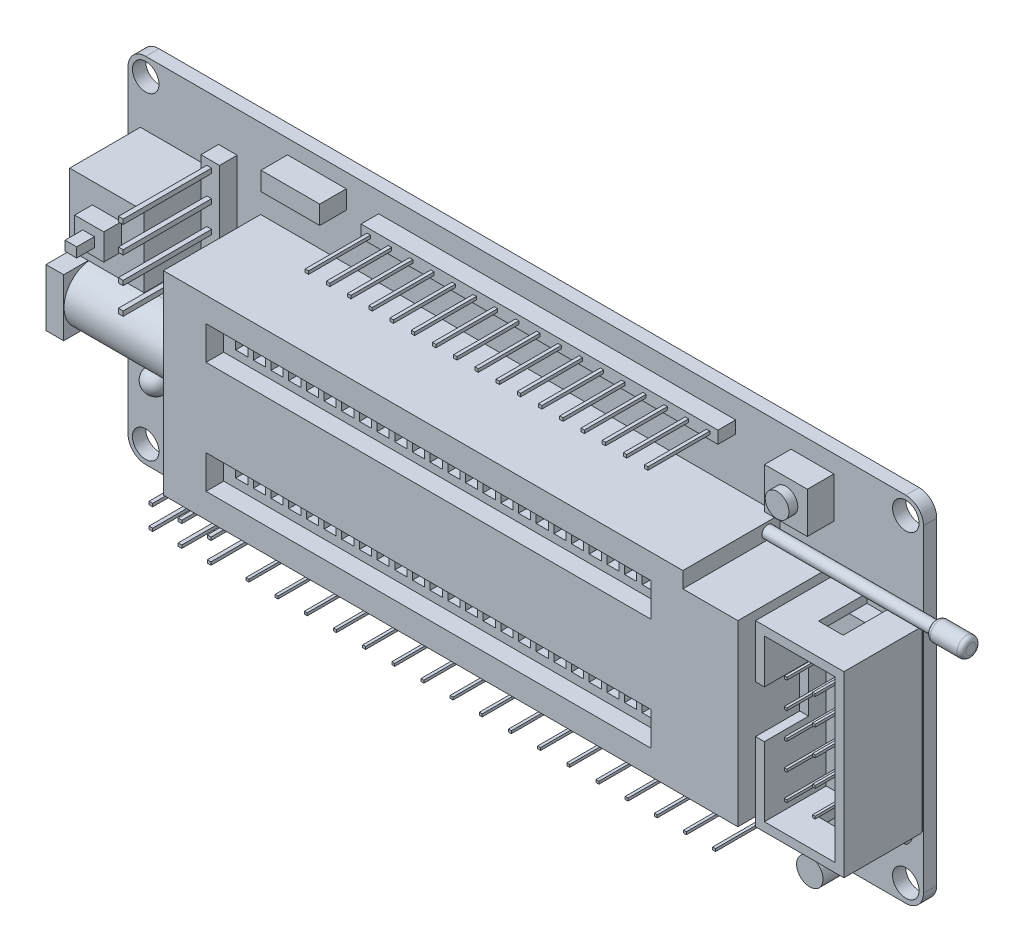
from build123d import *

# Parameters (mm, degrees)
SKETCH_1_W                = 90
SKETCH_1_H                = 40
EXTRUDE_1_DEPTH           = 1.5
SKETCH_2_W                = 65
SKETCH_2_H                = 22
EXTRUDE_2_DEPTH           = 11
SKETCH_3_W                = 6.225087501
SKETCH_3_H                = 1.796883592
CUT_EXTRUDE_1_DEPTH       = 69
SKETCH_4_W                = 10
SKETCH_4_H                = 20.203116408
EXTRUDE_3_DEPTH           = 9
SKETCH_5_W                = 8
SKETCH_5_H                = 18.203116408
CUT_EXTRUDE_3_DEPTH       = 9
SKETCH_6_W                = 2.774855054
SKETCH_6_H                = 5.475338092
CUT_EXTRUDE_4_DEPTH       = 1
SKETCH_7_W                = 2.774855054
SKETCH_7_H                = 5.475338092
CUT_EXTRUDE_5_DEPTH       = 1
SKETCH_8_W                = 8
SKETCH_8_H                = 18.203116408
EXTRUDE_4_DEPTH           = 2
SKETCH_9_W                = 0.285419249
SKETCH_9_H                = 0.292362524
EXTRUDE_5_DEPTH           = 7
PATTERN_LINEAR_1_COUNT    = 5
PATTERN_LINEAR_1_PITCH    = 3
SKETCH_10_W               = 50.34394713
SKETCH_10_H               = 3.791594345
CUT_EXTRUDE_6_DEPTH       = 2
SKETCH_11_W               = 9.860673025
SKETCH_11_H               = 5.03523729
SKETCH_11_W_2             = 56.436617954
SKETCH_11_H_2             = 1.888213984
EXTRUDE_6_DEPTH           = 2
SKETCH_12_W               = 13.626100034
SKETCH_12_H               = 6.476245966
EXTRUDE_7_DEPTH           = 6
SKETCH_13_R               = 3.238122983
EXTRUDE_8_DEPTH           = 13.5
SKETCH_14_W               = 6.561891238
SKETCH_14_H               = 6.476245966
EXTRUDE_9_DEPTH           = 2
SKETCH_15_R               = 2.43291979
CUT_EXTRUDE_7_DEPTH       = 12
SKETCH_16_R               = 0.262129878
EXTRUDE_10_DEPTH          = 10
SKETCH_17_W               = 8.42576521
SKETCH_17_H               = 8.004476949
EXTRUDE_11_DEPTH          = 8
SKETCH_18_W               = 3.290690735
SKETCH_18_H               = 2.961327036
EXTRUDE_12_DEPTH          = 2
SKETCH_19_W               = 1.308493341
SKETCH_19_H               = 1.101889129
EXTRUDE_13_DEPTH          = 2
SKETCH_20_W               = 2.106441302
SKETCH_20_H               = 11.164138903
EXTRUDE_14_DEPTH          = 2
SKETCH_21_W               = 4.844814995
SKETCH_21_H               = 4.634170865
EXTRUDE_15_DEPTH          = 3
SKETCH_22_R               = 1.343961461
EXTRUDE_16_DEPTH          = 1
FILLET_2_R                = 2
SKETCH_24_R               = 1.5
CUT_EXTRUDE_8_DEPTH       = 4
SKETCH_25_W               = 6.643715868
SKETCH_25_H               = 2.098015537
EXTRUDE_18_DEPTH          = 3
SKETCH_26_W               = 40.386799093
SKETCH_26_H               = 1.398677025
EXTRUDE_19_DEPTH          = 2
SKETCH_27_W               = 0.37978378
SKETCH_27_H               = 0.352656368
EXTRUDE_20_DEPTH          = 7
PATTERN_LINEAR_2_COUNT    = 17
PATTERN_LINEAR_2_PITCH    = 2.4
SKETCH_28_W               = 0.413208423
SKETCH_28_H               = 0.344340353
EXTRUDE_21_DEPTH          = 7
PATTERN_LINEAR_3_COUNT    = 3
PATTERN_LINEAR_3_PITCH    = 3.3
SKETCH_29_W               = 0.325528955
SKETCH_29_H               = 0.298401542
EXTRUDE_22_DEPTH          = 7
PATTERN_LINEAR_4_COUNT    = 17
PATTERN_LINEAR_4_PITCH    = 3.3
SKETCH_30_R               = 0.665362113
EXTRUDE_23_DEPTH          = 23
SKETCH_31_W               = 0.534821992
SKETCH_31_H               = 0.534821993
EXTRUDE_24_DEPTH          = 10
SKETCH_32_W               = 0.556921536
SKETCH_32_H               = 1.218265859
EXTRUDE_25_DEPTH          = 1
SKETCH_33_R               = 0.577662236
EXTRUDE_26_DEPTH          = 5
SKETCH_34_W               = 0.459120478
SKETCH_34_H               = 1.170459117
EXTRUDE_27_DEPTH          = 1
SKETCH_35_R               = 1.338295075
EXTRUDE_28_DEPTH          = 3
SKETCH_37_W               = 1.37126869
SKETCH_37_H               = 1.919776166
CUT_EXTRUDE_9_DEPTH       = 1
PATTERN_LINEAR_5_COUNT    = 24
PATTERN_LINEAR_5_PITCH    = 2
MIRROR_1_COPY_1_SKETCH_W  = 1.37126869
MIRROR_1_COPY_1_SKETCH_H  = 1.919776166
MIRROR_1_COPY_1_DEPTH     = 1
MIRROR_1_COPY_2_SKETCH_W  = 1.37126869
MIRROR_1_COPY_2_SKETCH_H  = 1.919776166
MIRROR_1_COPY_2_DEPTH     = 1
MIRROR_1_COPY_3_SKETCH_W  = 1.37126869
MIRROR_1_COPY_3_SKETCH_H  = 1.919776166
MIRROR_1_COPY_3_DEPTH     = 1
MIRROR_1_COPY_4_SKETCH_W  = 1.37126869
MIRROR_1_COPY_4_SKETCH_H  = 1.919776166
MIRROR_1_COPY_4_DEPTH     = 1
MIRROR_1_COPY_5_SKETCH_W  = 1.37126869
MIRROR_1_COPY_5_SKETCH_H  = 1.919776166
MIRROR_1_COPY_5_DEPTH     = 1
MIRROR_1_COPY_6_SKETCH_W  = 1.37126869
MIRROR_1_COPY_6_SKETCH_H  = 1.919776166
MIRROR_1_COPY_6_DEPTH     = 1
MIRROR_1_COPY_7_SKETCH_W  = 1.37126869
MIRROR_1_COPY_7_SKETCH_H  = 1.919776166
MIRROR_1_COPY_7_DEPTH     = 1
MIRROR_1_COPY_8_SKETCH_W  = 1.37126869
MIRROR_1_COPY_8_SKETCH_H  = 1.919776166
MIRROR_1_COPY_8_DEPTH     = 1
MIRROR_1_COPY_9_SKETCH_W  = 1.37126869
MIRROR_1_COPY_9_SKETCH_H  = 1.919776166
MIRROR_1_COPY_9_DEPTH     = 1
MIRROR_1_COPY_10_SKETCH_W = 1.37126869
MIRROR_1_COPY_10_SKETCH_H = 1.919776166
MIRROR_1_COPY_10_DEPTH    = 1
MIRROR_1_COPY_11_SKETCH_W = 1.37126869
MIRROR_1_COPY_11_SKETCH_H = 1.919776166
MIRROR_1_COPY_11_DEPTH    = 1
MIRROR_1_COPY_12_SKETCH_W = 1.37126869
MIRROR_1_COPY_12_SKETCH_H = 1.919776166
MIRROR_1_COPY_12_DEPTH    = 1
MIRROR_1_COPY_13_SKETCH_W = 1.37126869
MIRROR_1_COPY_13_SKETCH_H = 1.919776166
MIRROR_1_COPY_13_DEPTH    = 1
MIRROR_1_COPY_14_SKETCH_W = 1.37126869
MIRROR_1_COPY_14_SKETCH_H = 1.919776166
MIRROR_1_COPY_14_DEPTH    = 1
MIRROR_1_COPY_15_SKETCH_W = 1.37126869
MIRROR_1_COPY_15_SKETCH_H = 1.919776166
MIRROR_1_COPY_15_DEPTH    = 1
MIRROR_1_COPY_16_SKETCH_W = 1.37126869
MIRROR_1_COPY_16_SKETCH_H = 1.919776166
MIRROR_1_COPY_16_DEPTH    = 1
MIRROR_1_COPY_17_SKETCH_W = 1.37126869
MIRROR_1_COPY_17_SKETCH_H = 1.919776166
MIRROR_1_COPY_17_DEPTH    = 1
MIRROR_1_COPY_18_SKETCH_W = 1.37126869
MIRROR_1_COPY_18_SKETCH_H = 1.919776166
MIRROR_1_COPY_18_DEPTH    = 1
MIRROR_1_COPY_19_SKETCH_W = 1.37126869
MIRROR_1_COPY_19_SKETCH_H = 1.919776166
MIRROR_1_COPY_19_DEPTH    = 1
MIRROR_1_COPY_20_SKETCH_W = 1.37126869
MIRROR_1_COPY_20_SKETCH_H = 1.919776166
MIRROR_1_COPY_20_DEPTH    = 1
MIRROR_1_COPY_21_SKETCH_W = 1.37126869
MIRROR_1_COPY_21_SKETCH_H = 1.919776166
MIRROR_1_COPY_21_DEPTH    = 1
MIRROR_1_COPY_22_SKETCH_W = 1.37126869
MIRROR_1_COPY_22_SKETCH_H = 1.919776166
MIRROR_1_COPY_22_DEPTH    = 1
MIRROR_1_COPY_23_SKETCH_W = 1.37126869
MIRROR_1_COPY_23_SKETCH_H = 1.919776166
MIRROR_1_COPY_23_DEPTH    = 1
SKETCH_38_R               = 1.082743928
EXTRUDE_29_DEPTH          = 4
FILLET_3_R                = 0.5
SKETCH_39_R               = 1.5
EXTRUDE_30_DEPTH          = 7
SKETCH_41_W               = 0.342053881
SKETCH_41_H               = 0.863278842
EXTRUDE_31_DEPTH          = 1
SKETCH_42_R               = 0.5
EXTRUDE_32_DEPTH          = 5
SKETCH_43_W               = 2
SKETCH_43_H               = 5.366168078
CUT_EXTRUDE_10_DEPTH      = 5
SKETCH_44_W               = 0.619515708
SKETCH_44_H               = 6.476245966
CUT_EXTRUDE_11_DEPTH      = 0.1
SKETCH_46_W               = 0.219876874
SKETCH_46_H               = 20.203116408
CUT_EXTRUDE_12_DEPTH      = 0.1


with BuildPart() as part:
    # 草图1 → 凸台-拉伸1 (new body)
    with BuildSketch(Plane.XY):
        Rectangle(SKETCH_1_W, SKETCH_1_H)
    extrude(amount=EXTRUDE_1_DEPTH)

    # 草图2 → 凸台-拉伸2 (add)
    with BuildSketch(Plane.XY.offset(1.5)):
        with Locations((2.5, 0)):
            Rectangle(SKETCH_2_W, SKETCH_2_H)
    extrude(amount=EXTRUDE_2_DEPTH)

    # 草图3 → 切除-拉伸1 (cut)
    with BuildSketch(Plane.XY.offset(1.5)):
        with Locations((31.88745625, 10.101558204)):
            Rectangle(SKETCH_3_W, SKETCH_3_H)
    extrude(amount=CUT_EXTRUDE_1_DEPTH, mode=Mode.SUBTRACT)

    # 草图4 → 凸台-拉伸3 (add)
    with BuildSketch(Plane.XY.offset(1.5)):
        with Locations((40, -1.898441796)):
            Rectangle(SKETCH_4_W, SKETCH_4_H)
    extrude(amount=EXTRUDE_3_DEPTH)

    # 草图5 → 切除-拉伸3 (cut)
    with BuildSketch(Plane.XY.offset(10.5)):
        with Locations((40, -1.898441796)):
            Rectangle(SKETCH_5_W, SKETCH_5_H)
    extrude(amount=-CUT_EXTRUDE_3_DEPTH, mode=Mode.SUBTRACT)

    # 草图6 → 切除-拉伸4 (cut)
    with BuildSketch(Plane.XZ.offset(12)):
        with Locations((40, 4.237669046)):
            Rectangle(SKETCH_6_W, SKETCH_6_H)
    extrude(amount=-CUT_EXTRUDE_4_DEPTH, mode=Mode.SUBTRACT)

    # 草图7 → 切除-拉伸5 (cut)
    with BuildSketch(Plane.XZ.offset(-7.203116408)):
        with Locations((40, 4.237669046)):
            Rectangle(SKETCH_7_W, SKETCH_7_H)
    extrude(amount=-CUT_EXTRUDE_5_DEPTH, mode=Mode.SUBTRACT)

    # 草图8 → 凸台-拉伸4 (add)
    with BuildSketch(Plane.XY.offset(1.5)):
        with Locations((40, -1.898441796)):
            Rectangle(SKETCH_8_W, SKETCH_8_H)
    extrude(amount=EXTRUDE_4_DEPTH)

    # 草图9 → 凸台-拉伸5 (add)
    with BuildSketch(Plane.XY.offset(3.5)):
        with Locations((41.604609893, 4.276906518)):
            Rectangle(SKETCH_9_W, SKETCH_9_H)
        with Locations((38.395390107, 4.276906518)):
            Rectangle(SKETCH_9_W, SKETCH_9_H)
    extrude_5 = extrude(amount=EXTRUDE_5_DEPTH)

    # 阵列(线性)1: 凸台-拉伸5 ×5
    with Locations(*[(0, -i * PATTERN_LINEAR_1_PITCH, 0) for i in range(1, PATTERN_LINEAR_1_COUNT)]):
        add(extrude_5)

    # 草图10 → 切除-拉伸6 (cut)
    with BuildSketch(Plane.XY.offset(12.5)):
        with Locations((0, 6.319323908)):
            Rectangle(SKETCH_10_W, SKETCH_10_H)
        with Locations((0, -6.319323908)):
            Rectangle(SKETCH_10_W, SKETCH_10_H)
    extrude(amount=-CUT_EXTRUDE_6_DEPTH, mode=Mode.SUBTRACT)

    # 草图11 → 凸台-拉伸6 (add)
    with BuildSketch(Plane.XY.offset(1.5)):
        with Locations((-29.742403517, -15.797804223)):
            Rectangle(SKETCH_11_W, SKETCH_11_H)
        with Locations((4.665051295, -16.532109661)):
            Rectangle(SKETCH_11_W_2, SKETCH_11_H_2)
    extrude(amount=EXTRUDE_6_DEPTH)

    # 草图12 → 凸台-拉伸7 (add)
    with BuildSketch(Plane.XY.offset(1.5)):
        with Locations((-38.186949983, 0)):
            Rectangle(SKETCH_12_W, SKETCH_12_H)
    extrude(amount=EXTRUDE_7_DEPTH)

    # 草图13 → 凸台-拉伸8 (add)
    with BuildSketch(Plane.ZY.offset(45)):
        with Locations((7.5, 0)):
            Circle(SKETCH_13_R)
    extrude(amount=-EXTRUDE_8_DEPTH)

    # 草图14 → 凸台-拉伸9 (add)
    with BuildSketch(Plane.ZY.offset(45)):
        with Locations((7.5, 0)):
            Rectangle(SKETCH_14_W, SKETCH_14_H)
    extrude(amount=-EXTRUDE_9_DEPTH)

    # 草图15 → 切除-拉伸7 (cut)
    with BuildSketch(Plane.ZY.offset(45)):
        with Locations((7.340393145, 0)):
            Circle(SKETCH_15_R)
    extrude(amount=-CUT_EXTRUDE_7_DEPTH, mode=Mode.SUBTRACT)

    # 草图16 → 凸台-拉伸10 (add)
    with BuildSketch(Plane.ZY.offset(33)):
        with Locations((7.340393145, 0)):
            Circle(SKETCH_16_R)
    extrude(amount=EXTRUDE_10_DEPTH)

    # 草图17 → 凸台-拉伸11 (add)
    with BuildSketch(Plane.XY.offset(1.5)):
        with Locations((-39.390452357, 8.741731406)):
            Rectangle(SKETCH_17_W, SKETCH_17_H)
    extrude(amount=EXTRUDE_11_DEPTH)

    # 草图18 → 凸台-拉伸12 (add)
    with BuildSketch(Plane.XY.offset(9.5)):
        with Locations((-39.390452357, 8.942287584)):
            Rectangle(SKETCH_18_W, SKETCH_18_H)
    extrude(amount=EXTRUDE_12_DEPTH)

    # 草图19 → 凸台-拉伸13 (add)
    with BuildSketch(Plane.XY.offset(11.5)):
        with Locations((-39.466808754, 8.873419514)):
            Rectangle(SKETCH_19_W, SKETCH_19_H)
    extrude(amount=EXTRUDE_13_DEPTH)

    # 草图20 → 凸台-拉伸14 (add)
    with BuildSketch(Plane.XY.offset(1.5)):
        with Locations((-33.70306084, 9.900274122)):
            Rectangle(SKETCH_20_W, SKETCH_20_H)
    extrude(amount=EXTRUDE_14_DEPTH)

    # 草图21 → 凸台-拉伸15 (add)
    with BuildSketch(Plane.XY.offset(1.5)):
        with Locations((32.439196059, 15.692987704)):
            Rectangle(SKETCH_21_W, SKETCH_21_H)
    extrude(amount=EXTRUDE_15_DEPTH)

    # 草图22 → 凸台-拉伸16 (add)
    with BuildSketch(Plane.XY.offset(4.5)):
        with Locations((32.439196058, 15.742204428)):
            Circle(SKETCH_22_R)
    extrude(amount=EXTRUDE_16_DEPTH)

    # 圆角2
    fillet_2_edges = [part.edges().sort_by_distance(p)[0] for p in [
        (45, -20, 0.75),
        (-45, -20, 0.75),
        (-45, 20, 0.75),
        (45, 20, 0.75),
    ]]
    fillet(fillet_2_edges, radius=FILLET_2_R)

    # 草图24 → 切除-拉伸8 (cut)
    with BuildSketch(Plane.XY.offset(1.5)):
        with Locations((-43, -18)):
            Circle(SKETCH_24_R)
        with Locations((-43, 18)):
            Circle(SKETCH_24_R)
        with Locations((43, 18)):
            Circle(SKETCH_24_R)
        with Locations((43, -18)):
            Circle(SKETCH_24_R)
    extrude(amount=-CUT_EXTRUDE_8_DEPTH, mode=Mode.SUBTRACT)

    # 草图25 → 凸台-拉伸18 (add)
    with BuildSketch(Plane.XY.offset(1.5)):
        with Locations((-23.630953769, 17.312946387)):
            Rectangle(SKETCH_25_W, SKETCH_25_H)
    extrude(amount=EXTRUDE_18_DEPTH)

    # 草图26 → 凸台-拉伸19 (add)
    with BuildSketch(Plane.XY.offset(1.5)):
        with Locations((3.555830902, 17.050694445)):
            Rectangle(SKETCH_26_W, SKETCH_26_H)
    extrude(amount=EXTRUDE_19_DEPTH)

    # 草图27 → 凸台-拉伸20 (add)
    with BuildSketch(Plane.XY.offset(3.5)):
        with Locations((-15.764906068, 17.014648108)):
            Rectangle(SKETCH_27_W, SKETCH_27_H)
    extrude_20 = extrude(amount=EXTRUDE_20_DEPTH)

    # 阵列(线性)2: 凸台-拉伸20 ×17
    with Locations(*[(i * PATTERN_LINEAR_2_PITCH, 0, 0) for i in range(1, PATTERN_LINEAR_2_COUNT)]):
        add(extrude_20)

    # 草图28 → 凸台-拉伸21 (add)
    with BuildSketch(Plane.XY.offset(3.5)):
        with Locations((-33.418026477, -17.010820795)):
            Rectangle(SKETCH_28_W, SKETCH_28_H)
        with Locations((-33.418026477, -14.584787652)):
            Rectangle(SKETCH_28_W, SKETCH_28_H)
    extrude_21 = extrude(amount=EXTRUDE_21_DEPTH)

    # 阵列(线性)3: 凸台-拉伸21 ×3
    with Locations(*[(i * PATTERN_LINEAR_3_PITCH, 0, 0) for i in range(1, PATTERN_LINEAR_3_COUNT)]):
        add(extrude_21)

    # 草图29 → 凸台-拉伸22 (add)
    with BuildSketch(Plane.XY.offset(3.5)):
        with Locations((-22.486337303, -16.542478065)):
            Rectangle(SKETCH_29_W, SKETCH_29_H)
    extrude_22 = extrude(amount=EXTRUDE_22_DEPTH)

    # 阵列(线性)4: 凸台-拉伸22 ×17
    with Locations(*[(i * PATTERN_LINEAR_4_PITCH, 0, 0) for i in range(1, PATTERN_LINEAR_4_COUNT)]):
        add(extrude_22)

    # 草图30 → 凸台-拉伸23 (add)
    with BuildSketch(Plane(origin=(28.774912499, 0, 0), x_dir=(0, 0, -1), z_dir=(1, 0, 0))):
        with Locations((-2.894408373, 10.021852453)):
            Circle(SKETCH_30_R)
    extrude(amount=EXTRUDE_23_DEPTH)

    # 草图31 → 凸台-拉伸24 (add)
    with BuildSketch(Plane.XY.offset(3.5)):
        with Locations((-33.815877465, 14.509813634)):
            Rectangle(SKETCH_31_W, SKETCH_31_H)
        with Locations((-33.815877465, 11.509813634)):
            Rectangle(SKETCH_31_W, SKETCH_31_H)
        with Locations((-33.815877465, 8.509813634)):
            Rectangle(SKETCH_31_W, SKETCH_31_H)
        with Locations((-33.815877465, 5.509813634)):
            Rectangle(SKETCH_31_W, SKETCH_31_H)
    extrude(amount=EXTRUDE_24_DEPTH)

    # 草图32 → 凸台-拉伸25 (add)
    with BuildSketch(Plane.XY.offset(1.5)):
        with Locations((-41.264636917, -5.589032188)):
            Rectangle(SKETCH_32_W, SKETCH_32_H)
    extrude(amount=EXTRUDE_25_DEPTH)

    # 草图33 → 凸台-拉伸26 (add)
    with BuildSketch(Plane(origin=(-40.986176149, 0, 0), x_dir=(0, 0, -1), z_dir=(1, 0, 0))):
        with Locations(Location((-2.336977666, -5.579366415, 0), (0, 0, 253.607822852))):
            Circle(SKETCH_33_R)
    extrude(amount=EXTRUDE_26_DEPTH)

    # 草图34 → 凸台-拉伸27 (add)
    with BuildSketch(Plane.XY.offset(1.5)):
        with Locations((-35.75661591, -5.556339691)):
            Rectangle(SKETCH_34_W, SKETCH_34_H)
    extrude(amount=EXTRUDE_27_DEPTH)

    # 草图35 → 凸台-拉伸28 (add)
    with BuildSketch(Plane.XY.offset(1.5)):
        with Locations(Location((-38.851781054, -8.165199985, 0), (0, 0, 180))):
            Circle(SKETCH_35_R)
    extrude(amount=EXTRUDE_28_DEPTH)

    # 草图36 → 旋转1 (revolve)
    with BuildSketch(Plane.XY.offset(4.5)):
        with BuildLine():
            Line((-38.851781054, -6.82690491), (-38.851781054, -9.50349506))
            ThreePointArc((-38.851781054, -9.50349506), (-37.513485979, -8.165199985), (-38.851781054, -6.82690491))
        make_face()
    revolve(axis=Axis((-38.851781054, -8.165199985, 4.5), (0, -1, 0)))

    # 草图37 → 切除-拉伸9 (cut)
    with BuildSketch(Plane.XY.offset(10.5)):
        with Locations((-23.133000851, 6.276397943)):
            Rectangle(SKETCH_37_W, SKETCH_37_H)
    cut_extrude_9 = extrude(amount=-CUT_EXTRUDE_9_DEPTH, mode=Mode.SUBTRACT)

    # 阵列(线性)5: 切除-拉伸9 ×24
    with Locations(*[(i * PATTERN_LINEAR_5_PITCH, 0, 0) for i in range(1, PATTERN_LINEAR_5_COUNT)]):
        add(cut_extrude_9, mode=Mode.SUBTRACT)

    # 镜向1: 切除-拉伸9 across plane
    add(cut_extrude_9.mirror(Plane.ZX), mode=Mode.SUBTRACT)

    # 镜向1 copy 1 sketch → 镜向1 copy 1 (cut)
    with BuildSketch(Plane(origin=(2, 0, 10.5), x_dir=(1, 0, 0), z_dir=(0, 0, 1))):
        with Locations((-23.133000851, -6.276397943)):
            Rectangle(MIRROR_1_COPY_1_SKETCH_W, MIRROR_1_COPY_1_SKETCH_H)
    extrude(amount=-MIRROR_1_COPY_1_DEPTH, mode=Mode.SUBTRACT)

    # 镜向1 copy 2 sketch → 镜向1 copy 2 (cut)
    with BuildSketch(Plane(origin=(4, 0, 10.5), x_dir=(1, 0, 0), z_dir=(0, 0, 1))):
        with Locations((-23.133000851, -6.276397943)):
            Rectangle(MIRROR_1_COPY_2_SKETCH_W, MIRROR_1_COPY_2_SKETCH_H)
    extrude(amount=-MIRROR_1_COPY_2_DEPTH, mode=Mode.SUBTRACT)

    # 镜向1 copy 3 sketch → 镜向1 copy 3 (cut)
    with BuildSketch(Plane(origin=(6, 0, 10.5), x_dir=(1, 0, 0), z_dir=(0, 0, 1))):
        with Locations((-23.133000851, -6.276397943)):
            Rectangle(MIRROR_1_COPY_3_SKETCH_W, MIRROR_1_COPY_3_SKETCH_H)
    extrude(amount=-MIRROR_1_COPY_3_DEPTH, mode=Mode.SUBTRACT)

    # 镜向1 copy 4 sketch → 镜向1 copy 4 (cut)
    with BuildSketch(Plane(origin=(8, 0, 10.5), x_dir=(1, 0, 0), z_dir=(0, 0, 1))):
        with Locations((-23.133000851, -6.276397943)):
            Rectangle(MIRROR_1_COPY_4_SKETCH_W, MIRROR_1_COPY_4_SKETCH_H)
    extrude(amount=-MIRROR_1_COPY_4_DEPTH, mode=Mode.SUBTRACT)

    # 镜向1 copy 5 sketch → 镜向1 copy 5 (cut)
    with BuildSketch(Plane(origin=(10, 0, 10.5), x_dir=(1, 0, 0), z_dir=(0, 0, 1))):
        with Locations((-23.133000851, -6.276397943)):
            Rectangle(MIRROR_1_COPY_5_SKETCH_W, MIRROR_1_COPY_5_SKETCH_H)
    extrude(amount=-MIRROR_1_COPY_5_DEPTH, mode=Mode.SUBTRACT)

    # 镜向1 copy 6 sketch → 镜向1 copy 6 (cut)
    with BuildSketch(Plane(origin=(12, 0, 10.5), x_dir=(1, 0, 0), z_dir=(0, 0, 1))):
        with Locations((-23.133000851, -6.276397943)):
            Rectangle(MIRROR_1_COPY_6_SKETCH_W, MIRROR_1_COPY_6_SKETCH_H)
    extrude(amount=-MIRROR_1_COPY_6_DEPTH, mode=Mode.SUBTRACT)

    # 镜向1 copy 7 sketch → 镜向1 copy 7 (cut)
    with BuildSketch(Plane(origin=(14, 0, 10.5), x_dir=(1, 0, 0), z_dir=(0, 0, 1))):
        with Locations((-23.133000851, -6.276397943)):
            Rectangle(MIRROR_1_COPY_7_SKETCH_W, MIRROR_1_COPY_7_SKETCH_H)
    extrude(amount=-MIRROR_1_COPY_7_DEPTH, mode=Mode.SUBTRACT)

    # 镜向1 copy 8 sketch → 镜向1 copy 8 (cut)
    with BuildSketch(Plane(origin=(16, 0, 10.5), x_dir=(1, 0, 0), z_dir=(0, 0, 1))):
        with Locations((-23.133000851, -6.276397943)):
            Rectangle(MIRROR_1_COPY_8_SKETCH_W, MIRROR_1_COPY_8_SKETCH_H)
    extrude(amount=-MIRROR_1_COPY_8_DEPTH, mode=Mode.SUBTRACT)

    # 镜向1 copy 9 sketch → 镜向1 copy 9 (cut)
    with BuildSketch(Plane(origin=(18, 0, 10.5), x_dir=(1, 0, 0), z_dir=(0, 0, 1))):
        with Locations((-23.133000851, -6.276397943)):
            Rectangle(MIRROR_1_COPY_9_SKETCH_W, MIRROR_1_COPY_9_SKETCH_H)
    extrude(amount=-MIRROR_1_COPY_9_DEPTH, mode=Mode.SUBTRACT)

    # 镜向1 copy 10 sketch → 镜向1 copy 10 (cut)
    with BuildSketch(Plane(origin=(20, 0, 10.5), x_dir=(1, 0, 0), z_dir=(0, 0, 1))):
        with Locations((-23.133000851, -6.276397943)):
            Rectangle(MIRROR_1_COPY_10_SKETCH_W, MIRROR_1_COPY_10_SKETCH_H)
    extrude(amount=-MIRROR_1_COPY_10_DEPTH, mode=Mode.SUBTRACT)

    # 镜向1 copy 11 sketch → 镜向1 copy 11 (cut)
    with BuildSketch(Plane(origin=(22, 0, 10.5), x_dir=(1, 0, 0), z_dir=(0, 0, 1))):
        with Locations((-23.133000851, -6.276397943)):
            Rectangle(MIRROR_1_COPY_11_SKETCH_W, MIRROR_1_COPY_11_SKETCH_H)
    extrude(amount=-MIRROR_1_COPY_11_DEPTH, mode=Mode.SUBTRACT)

    # 镜向1 copy 12 sketch → 镜向1 copy 12 (cut)
    with BuildSketch(Plane(origin=(24, 0, 10.5), x_dir=(1, 0, 0), z_dir=(0, 0, 1))):
        with Locations((-23.133000851, -6.276397943)):
            Rectangle(MIRROR_1_COPY_12_SKETCH_W, MIRROR_1_COPY_12_SKETCH_H)
    extrude(amount=-MIRROR_1_COPY_12_DEPTH, mode=Mode.SUBTRACT)

    # 镜向1 copy 13 sketch → 镜向1 copy 13 (cut)
    with BuildSketch(Plane(origin=(26, 0, 10.5), x_dir=(1, 0, 0), z_dir=(0, 0, 1))):
        with Locations((-23.133000851, -6.276397943)):
            Rectangle(MIRROR_1_COPY_13_SKETCH_W, MIRROR_1_COPY_13_SKETCH_H)
    extrude(amount=-MIRROR_1_COPY_13_DEPTH, mode=Mode.SUBTRACT)

    # 镜向1 copy 14 sketch → 镜向1 copy 14 (cut)
    with BuildSketch(Plane(origin=(28, 0, 10.5), x_dir=(1, 0, 0), z_dir=(0, 0, 1))):
        with Locations((-23.133000851, -6.276397943)):
            Rectangle(MIRROR_1_COPY_14_SKETCH_W, MIRROR_1_COPY_14_SKETCH_H)
    extrude(amount=-MIRROR_1_COPY_14_DEPTH, mode=Mode.SUBTRACT)

    # 镜向1 copy 15 sketch → 镜向1 copy 15 (cut)
    with BuildSketch(Plane(origin=(30, 0, 10.5), x_dir=(1, 0, 0), z_dir=(0, 0, 1))):
        with Locations((-23.133000851, -6.276397943)):
            Rectangle(MIRROR_1_COPY_15_SKETCH_W, MIRROR_1_COPY_15_SKETCH_H)
    extrude(amount=-MIRROR_1_COPY_15_DEPTH, mode=Mode.SUBTRACT)

    # 镜向1 copy 16 sketch → 镜向1 copy 16 (cut)
    with BuildSketch(Plane(origin=(32, 0, 10.5), x_dir=(1, 0, 0), z_dir=(0, 0, 1))):
        with Locations((-23.133000851, -6.276397943)):
            Rectangle(MIRROR_1_COPY_16_SKETCH_W, MIRROR_1_COPY_16_SKETCH_H)
    extrude(amount=-MIRROR_1_COPY_16_DEPTH, mode=Mode.SUBTRACT)

    # 镜向1 copy 17 sketch → 镜向1 copy 17 (cut)
    with BuildSketch(Plane(origin=(34, 0, 10.5), x_dir=(1, 0, 0), z_dir=(0, 0, 1))):
        with Locations((-23.133000851, -6.276397943)):
            Rectangle(MIRROR_1_COPY_17_SKETCH_W, MIRROR_1_COPY_17_SKETCH_H)
    extrude(amount=-MIRROR_1_COPY_17_DEPTH, mode=Mode.SUBTRACT)

    # 镜向1 copy 18 sketch → 镜向1 copy 18 (cut)
    with BuildSketch(Plane(origin=(36, 0, 10.5), x_dir=(1, 0, 0), z_dir=(0, 0, 1))):
        with Locations((-23.133000851, -6.276397943)):
            Rectangle(MIRROR_1_COPY_18_SKETCH_W, MIRROR_1_COPY_18_SKETCH_H)
    extrude(amount=-MIRROR_1_COPY_18_DEPTH, mode=Mode.SUBTRACT)

    # 镜向1 copy 19 sketch → 镜向1 copy 19 (cut)
    with BuildSketch(Plane(origin=(38, 0, 10.5), x_dir=(1, 0, 0), z_dir=(0, 0, 1))):
        with Locations((-23.133000851, -6.276397943)):
            Rectangle(MIRROR_1_COPY_19_SKETCH_W, MIRROR_1_COPY_19_SKETCH_H)
    extrude(amount=-MIRROR_1_COPY_19_DEPTH, mode=Mode.SUBTRACT)

    # 镜向1 copy 20 sketch → 镜向1 copy 20 (cut)
    with BuildSketch(Plane(origin=(40, 0, 10.5), x_dir=(1, 0, 0), z_dir=(0, 0, 1))):
        with Locations((-23.133000851, -6.276397943)):
            Rectangle(MIRROR_1_COPY_20_SKETCH_W, MIRROR_1_COPY_20_SKETCH_H)
    extrude(amount=-MIRROR_1_COPY_20_DEPTH, mode=Mode.SUBTRACT)

    # 镜向1 copy 21 sketch → 镜向1 copy 21 (cut)
    with BuildSketch(Plane(origin=(42, 0, 10.5), x_dir=(1, 0, 0), z_dir=(0, 0, 1))):
        with Locations((-23.133000851, -6.276397943)):
            Rectangle(MIRROR_1_COPY_21_SKETCH_W, MIRROR_1_COPY_21_SKETCH_H)
    extrude(amount=-MIRROR_1_COPY_21_DEPTH, mode=Mode.SUBTRACT)

    # 镜向1 copy 22 sketch → 镜向1 copy 22 (cut)
    with BuildSketch(Plane(origin=(44, 0, 10.5), x_dir=(1, 0, 0), z_dir=(0, 0, 1))):
        with Locations((-23.133000851, -6.276397943)):
            Rectangle(MIRROR_1_COPY_22_SKETCH_W, MIRROR_1_COPY_22_SKETCH_H)
    extrude(amount=-MIRROR_1_COPY_22_DEPTH, mode=Mode.SUBTRACT)

    # 镜向1 copy 23 sketch → 镜向1 copy 23 (cut)
    with BuildSketch(Plane(origin=(46, 0, 10.5), x_dir=(1, 0, 0), z_dir=(0, 0, 1))):
        with Locations((-23.133000851, -6.276397943)):
            Rectangle(MIRROR_1_COPY_23_SKETCH_W, MIRROR_1_COPY_23_SKETCH_H)
    extrude(amount=-MIRROR_1_COPY_23_DEPTH, mode=Mode.SUBTRACT)

    # 草图38 → 凸台-拉伸29 (add)
    with BuildSketch(Plane(origin=(51.774912499, 0, 0), x_dir=(0, 0, -1), z_dir=(1, 0, 0))):
        with Locations((-2.894408373, 10.021852453)):
            Circle(SKETCH_38_R)
    extrude(amount=-EXTRUDE_29_DEPTH)

    # 圆角3
    # the kernel refuses this fillet: 0.5 mm, written as the material it takes off along each edge
    with BuildSketch(Plane(origin=(47.774912499, 10.021852453, 2.894408373), x_dir=(0, 0, -1), z_dir=(0, -1, 0))) as fillet_3_piece_1:
        with BuildLine():
            CenterArc((0.582743928, 0.493126997), FILLET_3_R, 279.510965919, 80.489034081)
            Line((1.082743928, 0.493126997), (1.092743928, 0.493126997))
            Line((1.092743928, 0.493126997), (1.092743928, 0))
            Line((1.092743928, 0), (1.082743928, -0.01))
            ThreePointArc((1.082743928, -0.01), (0.874053021, -0.01), (0.667014477, -0.00986254))
            Line((0.667014477, -0.00986254), (0.665362113, 0))
        make_face()
    revolve(axis=Axis((47.774912499, 10.021852453, 2.894408373), (1, 0, 0)), mode=Mode.SUBTRACT)
    with BuildSketch(Plane(origin=(51.774912499, 10.021852453, 2.894408373), x_dir=(0, 0, -1), z_dir=(0, -1, 0))) as fillet_3_piece_2:
        with BuildLine():
            CenterArc((1.082743928 - FILLET_3_R, -FILLET_3_R), FILLET_3_R, 0, 90)
            Line((1.082743928 - FILLET_3_R, 0), (1.082743928 - FILLET_3_R, FILLET_3_R * 0.02))
            Line((1.082743928 - FILLET_3_R, FILLET_3_R * 0.02), (1.082743928 + FILLET_3_R * 0.02, FILLET_3_R * 0.02))
            Line((1.082743928 + FILLET_3_R * 0.02, FILLET_3_R * 0.02), (1.082743928 + FILLET_3_R * 0.02, -FILLET_3_R))
            Line((1.082743928 + FILLET_3_R * 0.02, -FILLET_3_R), (1.082743928, -FILLET_3_R))
        make_face()
    revolve(axis=Axis((51.774912499, 10.021852453, 2.894408373), (1, 0, 0)), mode=Mode.SUBTRACT)

    # 草图39 → 凸台-拉伸30 (add)
    with BuildSketch(Plane.XY.offset(1.5)):
        with Locations(Location((39.137144106, -15.321439934, 0), (0, 0, 180))):
            Circle(SKETCH_39_R)
    extrude(amount=EXTRUDE_30_DEPTH)

    # 草图41 → 凸台-拉伸31 (add)
    with BuildSketch(Plane.XY.offset(1.5)):
        with Locations((38.757838883, -12.885782665)):
            Rectangle(SKETCH_41_W, SKETCH_41_H)
    extrude(amount=EXTRUDE_31_DEPTH)

    # 草图42 → 凸台-拉伸32 (add)
    with BuildSketch(Plane(origin=(38.928865824, 0, 0), x_dir=(0, 0, -1), z_dir=(1, 0, 0))):
        with Locations(Location((-2.153809941, -12.867841842, 0), (0, 0, 226.181187568))):
            Circle(SKETCH_42_R)
    extrude(amount=EXTRUDE_32_DEPTH)

    # 草图43 → 切除-拉伸10 (cut)
    with BuildSketch(Plane.XY.offset(10.5)):
        with Locations((36, -0.471275063)):
            Rectangle(SKETCH_43_W, SKETCH_43_H)
    extrude(amount=-CUT_EXTRUDE_10_DEPTH, mode=Mode.SUBTRACT)

    # 草图44 → 切除-拉伸11 (cut)
    with BuildSketch(Plane.ZY.offset(45)):
        with Locations((1.809757854, 0)):
            Rectangle(SKETCH_44_W, SKETCH_44_H)
    extrude(amount=-CUT_EXTRUDE_11_DEPTH, mode=Mode.SUBTRACT)

    # 草图46 → 切除-拉伸12 (cut)
    with BuildSketch(Plane(origin=(45, 0, 0), x_dir=(0, 0, -1), z_dir=(1, 0, 0))):
        with Locations((-1.609938437, -1.898441796)):
            Rectangle(SKETCH_46_W, SKETCH_46_H)
    extrude(amount=-CUT_EXTRUDE_12_DEPTH, mode=Mode.SUBTRACT)


solid = part.part
